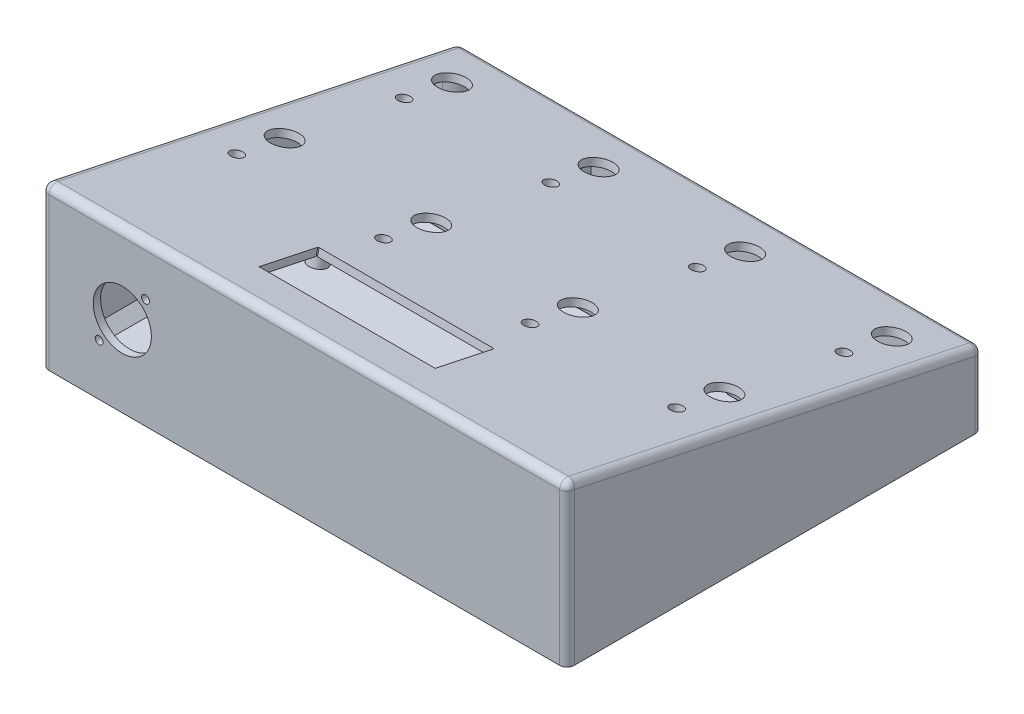
from build123d import *

# Parameters (mm, degrees)
FORME_BASE_PLAN_DROITE_DEPTH               = 215
COQUE1_T                                   = -3
ESQUISSE10_R                               = 6
ESQUISSE10_R_2                             = 2.6
PER_AGE_SWITCH_LED_DEPTH                   = 281.391917916
R_P_TITION_SWITCH_LED_COUNT                = 4
R_P_TITION_SWITCH_LED_PITCH                = 60
R_P_TITION_SWITCH_LED_COUNT_DIR2           = 2
R_P_TITION_SWITCH_LED_PITCH_DIR2           = 70
ESQUISSE13_W                               = 72
ESQUISSE13_H                               = 24.7
PER_AGE_CRAN_DEPTH                         = 3
PLOT_START                                 = -3
ESQUISSE14_R                               = 3.6
ESQUISSE14_R_2                             = 2.1
PLOT_CRAN_DEPTH                            = 7
R_P_TITION_PLOTS_ECRAN_COUNT               = 2
R_P_TITION_PLOTS_ECRAN_PITCH               = 75.4
R_P_TITION_PLOTS_ECRAN_COUNT_DIR2          = 2
R_P_TITION_PLOTS_ECRAN_PITCH_DIR2          = 31.4
BOSS_EXTRU_PLOTS_PICO_DEPTH                = 6
BOSS_EXTRU_PLOTS_PICO_DEPTH_BACK           = 2
ESQUISSE16_R                               = 3
D_POUILLE_PLOTS_PICO_ANGLE                 = 7.13
ESQUISSE18_R                               = 1.05
PER_AGE_PLOT_PICO_DEPTH                    = 7
ESQUISSE26_R                               = 11.9
ESQUISSE26_R_2                             = 1.6
ENL_V_MAT_EXTRU_4_DEPTH                    = 3
RENFORT_4_COINS_REACH                      = 283.924
ESQUISSE28_W                               = 9
ESQUISSE28_H                               = 9
R_P_TITION_4_COINS_OUTLINE_W               = 9
R_P_TITION_4_COINS_OUTLINE_H               = 9
R_P_TITION_4_COINS_DEPTH                   = 63
R_P_TITION_4_COINS_2_OUTLINE_W             = 9
R_P_TITION_4_COINS_2_OUTLINE_H             = 9
R_P_TITION_4_COINS_2_DEPTH                 = 29.474647714
BLOC_VIS_PROFONDEUR_DEPTH                  = 4.05
PLOT_VIS_LARGEUR_DEPTH                     = 4.05
PLOT_VIS_LARGEUR_R_P_TITION_COUNT          = 2
PLOT_VIS_LARGEUR_R_P_TITION_PITCH          = 107.5
PLOT_VIS_LARGEUR_R_P_TITION_COPY_1_DEPTH   = 4.05
ASSISE_COUVERCLE_PROFONDEUR_DEPTH          = 158
ASSISE_COUVERCLE_LARGEUR_DEPTH             = 203
ESQUISSE45_R                               = 4.45
TROU_PATINS_DEPTH                          = 4
R_P_TITION_PATINS_COUNT                    = 2
R_P_TITION_PATINS_PITCH                    = 158
R_P_TITION_PATINS_COUNT_DIR2               = 2
R_P_TITION_PATINS_PITCH_DIR2               = 203
BOSS_EXTRU_14_DEPTH                        = 15
BOSS_EXTRU_14_DEPTH_BACK                   = 2
ESQUISSE50_W                               = 209
ESQUISSE50_H                               = 4
ENL_V_MAT_EXTRU_6_REACH                    = 247.01
ESQUISSE59_R                               = 2.1
TROU_VIS_LARGEUR_DEPTH                     = 7
R_P_TITION_TROU_VIS_LARGEUR_COUNT          = 2
R_P_TITION_TROU_VIS_LARGEUR_PITCH          = 107.5
R_P_TITION_TROU_VIS_LARGEUR_COPY_1_SKETC_R = 2.1
R_P_TITION_TROU_VIS_LARGEUR_COPY_1_DEPTH   = 7
ESQUISSE62_R                               = 2.1
TROU_VIS_LONGEUR_DEPTH                     = 7
CONG_1_R                                   = 6
CONG_3_START                               = 3
CONG_3_DEPTH                               = 155.844279517
CONG_5_START                               = 3
CONG_5_DEPTH                               = 209
CONG_8_R                                   = 3
ENL_V_START                                = -2
ESQUISSE63_R                               = 2.1
ENL_V_MAT_EXTRU_9_DEPTH                    = 2
BOSS_EXTRU_17_DEPTH                        = 3
ESQUISSE68_R                               = 1.575
ENL_V_MAT_EXTRU_10_DEPTH                   = 3
ESQUISSE69_R                               = 1.575
ENL_V_MAT_EXTRU_11_DEPTH                   = 3
SYM_TRIE7_COPY_1_SKETCH_R                  = 1.575
SYM_TRIE7_COPY_1_DEPTH                     = 3
ENL_V_MAT_EXTRU_12_DEPTH                   = 2
ENL_V_MAT_EXTRU_14_DEPTH                   = 2
SYM_TRIE13_COPY_1_DEPTH                    = 2


with BuildPart() as part:
    # Esquisse1 → Forme base plan droite (new body)
    with BuildSketch(Plane(origin=(0, 0, 0), x_dir=(0, 0, -1), z_dir=(1, 0, 0))):
        Polygon((0, 0), (-170, 0), (-170, 66), (0, 30), align=None)
    extrude(amount=FORME_BASE_PLAN_DROITE_DEPTH)

    # Coque1
    coque1_openings = [part.faces().sort_by_distance(p)[0] for p in [
        (107.5, 0, 85),
    ]]
    offset(amount=COQUE1_T, openings=coque1_openings, kind=Kind.INTERSECTION)

    # Esquisse10 → Perçage switch-LED (cut, through all)
    with BuildSketch(Plane(origin=(0, 28.71241224, -6.080275533), x_dir=(1, 0, 0), z_dir=(0, 0.9783048645494206, -0.20717044190458303))):
        with Locations(Location((197.5, -26.215113257, 0), (0, 0, 270))):
            Circle(ESQUISSE10_R)
        with Locations(Location((197.5, -46.215113257, 0), (0, 0, 270))):
            Circle(ESQUISSE10_R_2)
    per_age_switch_led = extrude(amount=-PER_AGE_SWITCH_LED_DEPTH, mode=Mode.SUBTRACT)

    # Répétition switch-LED: Per_age switch-LED 4 × 2
    with Locations(*[Vector(-1, 0, 0) * (i * R_P_TITION_SWITCH_LED_PITCH) + Vector(0, 0.207170441904583, 0.9783048645494204) * (j * R_P_TITION_SWITCH_LED_PITCH_DIR2) for i in range(R_P_TITION_SWITCH_LED_COUNT) for j in range(R_P_TITION_SWITCH_LED_COUNT_DIR2) if (i, j) != (0, 0)]):
        add(per_age_switch_led, mode=Mode.SUBTRACT)

    # Esquisse13 → Perçage écran (cut)
    with BuildSketch(Plane(origin=(0, 28.71241224, -6.080275533), x_dir=(1, 0, 0), z_dir=(0, 0.9783048645494206, -0.20717044190458303))):
        with Locations((107.5, -149.735076139)):
            Rectangle(ESQUISSE13_W, ESQUISSE13_H)
    extrude(amount=-PER_AGE_CRAN_DEPTH, mode=Mode.SUBTRACT)

    # Esquisse14 → Plot écran (add)
    with BuildSketch(Plane(origin=(0, 25.777497646, -5.458764207), x_dir=(1, 0, 0), z_dir=(0, -0.9783048645494206, 0.20717044190458303)).offset(PLOT_START)):
        with Locations(Location((69.75, 165.835076139, 0), (0, 0, 270))):
            Circle(ESQUISSE14_R)
        with Locations(Location((69.75, 165.835076139, 0), (0, 0, 270))):
            Circle(ESQUISSE14_R_2, mode=Mode.SUBTRACT)
    plot_cran = extrude(amount=PLOT_CRAN_DEPTH)

    # Répétition plots Ecran: Plot _cran 2 × 2
    with Locations(*[Vector(1, 0, 0) * (i * R_P_TITION_PLOTS_ECRAN_PITCH) + Vector(0, -0.20717044190458217, -0.9783048645494207) * (j * R_P_TITION_PLOTS_ECRAN_PITCH_DIR2) for i in range(R_P_TITION_PLOTS_ECRAN_COUNT) for j in range(R_P_TITION_PLOTS_ECRAN_COUNT_DIR2) if (i, j) != (0, 0)]):
        add(plot_cran)

    # Esquisse16 → Boss.-Extru.  plots  pico (add, two sides: drawn at the far end of the back side and taken through both)
    with BuildSketch(Plane(origin=(0, 25.777497646, -5.458764207), x_dir=(-1, 0, 0), z_dir=(0, -0.9783048645494206, 0.20717044190458303)).offset(-BOSS_EXTRU_PLOTS_PICO_DEPTH_BACK)):
        with Locations(Location((-161.8, -149.859880815, 0), (0, 0, 90))):
            Circle(ESQUISSE16_R)
        with Locations(Location((-173.2, -149.859880815, 0), (0, 0, 90))):
            Circle(ESQUISSE16_R)
        with Locations(Location((-161.8, -102.859880815, 0), (0, 0, 90))):
            Circle(ESQUISSE16_R)
        with Locations(Location((-173.2, -102.859880815, 0), (0, 0, 90))):
            Circle(ESQUISSE16_R)
    extrude(amount=BOSS_EXTRU_PLOTS_PICO_DEPTH + BOSS_EXTRU_PLOTS_PICO_DEPTH_BACK)

    # Dépouille plots pico
    d_pouille_plots_pico_faces = [part.faces().sort_by_distance(p)[0] for p in [
        (161.8, 44.773621341, 98.72598348),
        (173.2, 44.773621341, 98.72598348),
        (173.2, 54.510632111, 144.706312114),
        (161.8, 54.510632111, 144.706312114),
    ]]
    draft(d_pouille_plots_pico_faces, Plane(origin=(215, 63.065085406, 170.621511326), x_dir=(0, -0.20717044190458306, -0.9783048645494204), z_dir=(0, -0.9783048645494204, 0.20717044190458306)), D_POUILLE_PLOTS_PICO_ANGLE)

    # Esquisse18 → Perçage plot pico (cut)
    with BuildSketch(Plane(origin=(0, 19.907668459, -4.215741556), x_dir=(1, 0, 0), z_dir=(0, -0.9783048645494206, 0.207170441904583))):
        with Locations(Location((161.8, 149.859880815, 0), (0, 0, 270))):
            Circle(ESQUISSE18_R)
        with Locations(Location((173.2, 149.859880815, 0), (0, 0, 270))):
            Circle(ESQUISSE18_R)
        with Locations(Location((161.8, 102.859880815, 0), (0, 0, 270))):
            Circle(ESQUISSE18_R)
        with Locations(Location((173.2, 102.859880815, 0), (0, 0, 270))):
            Circle(ESQUISSE18_R)
    extrude(amount=-PER_AGE_PLOT_PICO_DEPTH, mode=Mode.SUBTRACT)

    # Esquisse26 → Enlèv. mat.-Extru.4 (cut)
    with BuildSketch(Plane.XY.offset(170)):
        with Locations((33, 33)):
            Circle(ESQUISSE26_R)
        with Locations((23.5, 21)):
            Circle(ESQUISSE26_R_2)
        with Locations((42.5, 45)):
            Circle(ESQUISSE26_R_2)
    extrude(amount=-ENL_V_MAT_EXTRU_4_DEPTH, mode=Mode.SUBTRACT)

    # Renfort 4 coins: up to this plane
    renfort_4_coins_end = Plane(origin=(215, 63.065085406, 170.621511326), z_dir=(0, -0.9783048645494204, 0.20717044190458306))
    # Esquisse28 → Renfort 4 coins (add, up to the surface)
    with BuildSketch(Plane.XZ, mode=Mode.PRIVATE) as renfort_4_coins_sk1:
        with Locations((207.5, 7.5)):
            Rectangle(ESQUISSE28_W, ESQUISSE28_H)
    renfort_4_coins_tool1 = split(extrude(renfort_4_coins_sk1.sketch, amount=-RENFORT_4_COINS_REACH, mode=Mode.PRIVATE), bisect_by=renfort_4_coins_end, keep=Keep.BOTH, mode=Mode.PRIVATE)
    add(renfort_4_coins_tool1.solids().sort_by_distance((207.5, 0, 7.5))[0])

    # Répétition 4 coins: read off the stored shape, not the designer's step
    # Répétition 4 coins outline → Répétition 4 coins (add)
    with BuildSketch(Plane(origin=(0, 0, 0), x_dir=(1, 0, 0), z_dir=(0, 1, 0))):
        with Locations((207.5, -162.5)):
            Rectangle(R_P_TITION_4_COINS_OUTLINE_W, R_P_TITION_4_COINS_OUTLINE_H)
        with Locations((7.5, -162.5)):
            Rectangle(R_P_TITION_4_COINS_OUTLINE_W, R_P_TITION_4_COINS_OUTLINE_H)
    extrude(amount=R_P_TITION_4_COINS_DEPTH)

    # R_p_tition 4 coins 2 outline → R_p_tition 4 coins 2 (add)
    with BuildSketch(Plane(origin=(0, 0, 0), x_dir=(1, 0, 0), z_dir=(0, 1, 0))):
        with Locations((7.5, -7.5)):
            Rectangle(R_P_TITION_4_COINS_2_OUTLINE_W, R_P_TITION_4_COINS_2_OUTLINE_H)
    extrude(amount=R_P_TITION_4_COINS_2_DEPTH)

    # Esquisse36 → Bloc  vis  profondeur (add, symmetric)
    with BuildSketch(Plane.XY.offset(85)):
        Polygon((212, 3), (203.9, 3), (203.9, 13), (212, 21.1), (212, 13), align=None)
    bloc_vis_profondeur = extrude(amount=BLOC_VIS_PROFONDEUR_DEPTH, both=True)

    # Symétrie2: Bloc  vis  profondeur across plane
    add(bloc_vis_profondeur.mirror(Plane(origin=(107.5, 0, 0), x_dir=(0, 0, 1), z_dir=(1, 0, 0))))

    # Esquisse39 → plot vis largeur (add, symmetric)
    with BuildSketch(Plane(origin=(53.75, 0, 0), x_dir=(0, 0, -1), z_dir=(1, 0, 0))):
        Polygon((-11.1, 13), (-3, 21.1), (-3, 13), (-3, 3), (-11.1, 3), align=None)
    plot_vis_largeur = extrude(amount=PLOT_VIS_LARGEUR_DEPTH, both=True)

    # plot vis largeur symétrie: plot vis largeur across plane
    add(plot_vis_largeur.mirror(Plane.XY.offset(85)))

    # plot vis largeur répétition: plot vis largeur ×2
    with Locations(*[(i * PLOT_VIS_LARGEUR_R_P_TITION_PITCH, 0, 0) for i in range(1, PLOT_VIS_LARGEUR_R_P_TITION_COUNT)]):
        add(plot_vis_largeur)

    # plot vis largeur répétition copy 1 sketc → plot vis largeur répétition copy 1 (add, symmetric)
    with BuildSketch(Plane(origin=(161.25, 0, 170), x_dir=(0, 0, 1), z_dir=(1, 0, 0))):
        Polygon((-11.1, -13), (-3, -21.1), (-3, -13), (-3, -3), (-11.1, -3), align=None)
    extrude(amount=PLOT_VIS_LARGEUR_R_P_TITION_COPY_1_DEPTH, both=True)

    # Esquisse42 → assise couvercle profondeur (add, through all)
    with BuildSketch(Plane(origin=(0, 0, 158), x_dir=(-1, 0, 0), z_dir=(0, 0, -1))):
        Polygon((-3, 3), (-7.05, 3), (-3, 7.05), align=None)
    assise_couvercle_profondeur = extrude(amount=ASSISE_COUVERCLE_PROFONDEUR_DEPTH)

    # Symétrie assise couvercle profondeur: assise couvercle profondeur across plane
    add(assise_couvercle_profondeur.mirror(Plane(origin=(107.5, 0, 0), x_dir=(0, 0, 1), z_dir=(1, 0, 0))))

    # Esquisse43 → Assise couvercle largeur (add, through all)
    with BuildSketch(Plane(origin=(12, 0, 0), x_dir=(0, 0, -1), z_dir=(1, 0, 0))):
        Polygon((-167, 3), (-162.95, 3), (-167, 7.05), align=None)
    assise_couvercle_largeur = extrude(amount=ASSISE_COUVERCLE_LARGEUR_DEPTH)

    # Symétrie Assise couvercle largeur: Assise couvercle largeur across plane
    add(assise_couvercle_largeur.mirror(Plane.XY.offset(85)))

    # Esquisse45 → Trou patins (cut)
    with BuildSketch(Plane.XZ):
        with Locations(Location((6, 6, 0), (0, 0, 270))):
            Circle(ESQUISSE45_R)
    trou_patins = extrude(amount=-TROU_PATINS_DEPTH, mode=Mode.SUBTRACT)

    # Répétition patins: Trou patins 2 × 2
    with Locations(*[(j * R_P_TITION_PATINS_PITCH_DIR2, 0, i * R_P_TITION_PATINS_PITCH) for i in range(R_P_TITION_PATINS_COUNT) for j in range(R_P_TITION_PATINS_COUNT_DIR2) if (i, j) != (0, 0)]):
        add(trou_patins, mode=Mode.SUBTRACT)

    # Esquisse50 → Boss.-Extru.14 (add, two sides: drawn at the far end of the back side and taken through both)
    with BuildSketch(Plane(origin=(0, 25.777497646, -5.458764207), x_dir=(1, 0, 0), z_dir=(0, -0.9783048645494204, 0.20717044190458306)).offset(-BOSS_EXTRU_14_DEPTH_BACK)):
        with Locations((107.5, 68.215113257)):
            Rectangle(ESQUISSE50_W, ESQUISSE50_H)
    extrude(amount=BOSS_EXTRU_14_DEPTH + BOSS_EXTRU_14_DEPTH_BACK)

    # Esquisse51 → Enlèv. mat.-Extru.6 (cut, up to next)
    with BuildSketch(Plane(origin=(0, 13.717814274, 64.778567406), x_dir=(-1, 0, 0), z_dir=(0, -0.20717044190458314, -0.9783048645494204)), mode=Mode.PRIVATE) as enl_v_mat_extru_6_sk1:
        with BuildLine():
            Line((-158.616222669, 11.349145936), (-176.383777331, 11.349145936))
            ThreePointArc((-176.383777331, 11.349145936), (-167.5, 20.232923267), (-158.616222669, 11.349145936))
        make_face()
    enl_v_mat_extru_6_tool1 = extrude(enl_v_mat_extru_6_sk1.sketch, amount=-ENL_V_MAT_EXTRU_6_REACH, mode=Mode.PRIVATE) & part.part
    add(enl_v_mat_extru_6_tool1.solids().sort_by_distance((167.5, 28.509332, 61.646246))[0], mode=Mode.SUBTRACT)

    # Esquisse59 → Trou vis largeur (cut)
    with BuildSketch(Plane.XZ.offset(-3)):
        with Locations(Location((53.75, 7.05, 0), (0, 0, 270))):
            Circle(ESQUISSE59_R)
    trou_vis_largeur = extrude(amount=-TROU_VIS_LARGEUR_DEPTH, mode=Mode.SUBTRACT)

    # Symétrie3 Trou vis largeur: Trou vis largeur across plane
    add(trou_vis_largeur.mirror(Plane.XY.offset(85)), mode=Mode.SUBTRACT)

    # Répétition Trou vis largeur: Trou vis largeur ×2
    with Locations(*[(i * R_P_TITION_TROU_VIS_LARGEUR_PITCH, 0, 0) for i in range(1, R_P_TITION_TROU_VIS_LARGEUR_COUNT)]):
        add(trou_vis_largeur, mode=Mode.SUBTRACT)

    # Répétition Trou vis largeur copy 1 sketc → Répétition Trou vis largeur copy 1 (cut)
    with BuildSketch(Plane(origin=(107.5, 3, 170), x_dir=(1, 0, 0), z_dir=(0, -1, 0))):
        with Locations((53.75, -7.05)):
            Circle(R_P_TITION_TROU_VIS_LARGEUR_COPY_1_SKETC_R)
    extrude(amount=-R_P_TITION_TROU_VIS_LARGEUR_COPY_1_DEPTH, mode=Mode.SUBTRACT)

    # Esquisse62 → trou vis longeur (cut)
    with BuildSketch(Plane.XZ.offset(-3)):
        with Locations((7.05, 85)):
            Circle(ESQUISSE62_R)
    trou_vis_longeur = extrude(amount=-TROU_VIS_LONGEUR_DEPTH, mode=Mode.SUBTRACT)

    # Symétrie4: trou vis longeur across plane
    add(trou_vis_longeur.mirror(Plane(origin=(107.5, 0, 0), x_dir=(0, 0, 1), z_dir=(1, 0, 0))), mode=Mode.SUBTRACT)

    # Congé1
    # the kernel refuses this fillet: 6 mm, written as the material it takes off along each edge
    with BuildSketch(Plane(origin=(203, -15, 12), x_dir=(0, 0, -1), z_dir=(0, 1, 0))) as cong_1_piece_1_section:
        with BuildLine():
            CenterArc((CONG_1_R, -CONG_1_R), CONG_1_R, 90, 90)
            Line((0, -CONG_1_R), (0, 0))
            Line((0, 0), (CONG_1_R, 0))
        make_face()
    cong_1_piece_1 = extrude(amount=59.474647714, mode=Mode.PRIVATE)
    cong_1_piece_1 = split(cong_1_piece_1, bisect_by=Plane(origin=(203, 3, 12), z_dir=(0, -1, 0)), keep=Keep.TOP, mode=Mode.PRIVATE)
    add(cong_1_piece_1, mode=Mode.SUBTRACT)
    with BuildSketch(Plane(origin=(203, -15, 12), x_dir=(0, 0, -1), z_dir=(0, 1, 0))) as cong_1_piece_2_section:
        with BuildLine():
            CenterArc((CONG_1_R, -CONG_1_R), CONG_1_R, 90, 90)
            Line((0, -CONG_1_R), (0, 0))
            Line((0, 0), (CONG_1_R, 0))
        make_face()
    cong_1_piece_2 = extrude(amount=59.474647714, mode=Mode.PRIVATE)
    cong_1_piece_2 = split(cong_1_piece_2, bisect_by=Plane(origin=(203, 27.56581398, 2.986062922), z_dir=(0, -0.9783048645494204, 0.207170441904583)), keep=Keep.TOP, mode=Mode.PRIVATE)
    cong_1_piece_2 = split(cong_1_piece_2, bisect_by=Plane(origin=(203, -8.475, 18.525), z_dir=(0, 0.7071067811865483, 0.7071067811865468)), keep=Keep.TOP, mode=Mode.PRIVATE)
    cong_1_piece_2 = split(cong_1_piece_2, bisect_by=Plane(origin=(196.475, -8.475, 12), z_dir=(-0.7071067811865478, 0.7071067811865474, 0)), keep=Keep.TOP, mode=Mode.PRIVATE)
    add(cong_1_piece_2, mode=Mode.SUBTRACT)
    with BuildSketch(Plane(origin=(203, -15, 158), x_dir=(1, 0, 0), z_dir=(0, 1, 0))) as cong_1_piece_3_section:
        with BuildLine():
            CenterArc((CONG_1_R, -CONG_1_R), CONG_1_R, 90, 90)
            Line((0, -CONG_1_R), (0, 0))
            Line((0, 0), (CONG_1_R, 0))
        make_face()
    cong_1_piece_3 = extrude(amount=90.392294773, mode=Mode.PRIVATE)
    cong_1_piece_3 = split(cong_1_piece_3, bisect_by=Plane(origin=(203, 3, 158), z_dir=(0, -1, 0)), keep=Keep.TOP, mode=Mode.PRIVATE)
    add(cong_1_piece_3, mode=Mode.SUBTRACT)
    with BuildSketch(Plane(origin=(203, -15, 158), x_dir=(1, 0, 0), z_dir=(0, 1, 0))) as cong_1_piece_4_section:
        with BuildLine():
            CenterArc((CONG_1_R, -CONG_1_R), CONG_1_R, 90, 90)
            Line((0, -CONG_1_R), (0, 0))
            Line((0, 0), (CONG_1_R, 0))
        make_face()
    cong_1_piece_4 = extrude(amount=90.392294773, mode=Mode.PRIVATE)
    cong_1_piece_4 = split(cong_1_piece_4, bisect_by=Plane(origin=(203, 57.156488241, 142.71980249), z_dir=(0, -0.9783048645494204, 0.207170441904583)), keep=Keep.TOP, mode=Mode.PRIVATE)
    cong_1_piece_4 = split(cong_1_piece_4, bisect_by=Plane(origin=(196.475, -8.475, 158), z_dir=(-0.7071067811865478, 0.7071067811865474, 0)), keep=Keep.TOP, mode=Mode.PRIVATE)
    cong_1_piece_4 = split(cong_1_piece_4, bisect_by=Plane(origin=(203, -8.475, 151.475), z_dir=(0, 0.7071067811865483, -0.7071067811865468)), keep=Keep.TOP, mode=Mode.PRIVATE)
    add(cong_1_piece_4, mode=Mode.SUBTRACT)
    with BuildSketch(Plane(origin=(12, -15, 12), x_dir=(0, 0, -1), z_dir=(0, 1, 0))) as cong_1_piece_5_section:
        with BuildLine():
            CenterArc((CONG_1_R, CONG_1_R), CONG_1_R, 180, 90)
            Line((0, CONG_1_R), (0, 0))
            Line((0, 0), (CONG_1_R, 0))
        make_face()
    cong_1_piece_5 = extrude(amount=59.474647714, mode=Mode.PRIVATE)
    cong_1_piece_5 = split(cong_1_piece_5, bisect_by=Plane(origin=(12, 3, 12), z_dir=(0, -1, 0)), keep=Keep.TOP, mode=Mode.PRIVATE)
    add(cong_1_piece_5, mode=Mode.SUBTRACT)
    with BuildSketch(Plane(origin=(12, -15, 12), x_dir=(0, 0, -1), z_dir=(0, 1, 0))) as cong_1_piece_6_section:
        with BuildLine():
            CenterArc((CONG_1_R, CONG_1_R), CONG_1_R, 180, 90)
            Line((0, CONG_1_R), (0, 0))
            Line((0, 0), (CONG_1_R, 0))
        make_face()
    cong_1_piece_6 = extrude(amount=59.474647714, mode=Mode.PRIVATE)
    cong_1_piece_6 = split(cong_1_piece_6, bisect_by=Plane(origin=(12, -8.475, 18.525), z_dir=(0, 0.7071067811865483, 0.7071067811865468)), keep=Keep.TOP, mode=Mode.PRIVATE)
    cong_1_piece_6 = split(cong_1_piece_6, bisect_by=Plane(origin=(12, 27.56581398, 2.986062922), z_dir=(0, -0.9783048645494204, 0.207170441904583)), keep=Keep.TOP, mode=Mode.PRIVATE)
    cong_1_piece_6 = split(cong_1_piece_6, bisect_by=Plane(origin=(18.525, -8.475, 12), z_dir=(0.7071067811865478, 0.7071067811865474, 0)), keep=Keep.TOP, mode=Mode.PRIVATE)
    add(cong_1_piece_6, mode=Mode.SUBTRACT)
    with BuildSketch(Plane(origin=(12, -15, 158), x_dir=(-1, 0, 0), z_dir=(0, 1, 0))) as cong_1_piece_7_section:
        with BuildLine():
            CenterArc((CONG_1_R, CONG_1_R), CONG_1_R, 180, 90)
            Line((0, CONG_1_R), (0, 0))
            Line((0, 0), (CONG_1_R, 0))
        make_face()
    cong_1_piece_7 = extrude(amount=90.392294773, mode=Mode.PRIVATE)
    cong_1_piece_7 = split(cong_1_piece_7, bisect_by=Plane(origin=(12, 3, 158), z_dir=(0, -1, 0)), keep=Keep.TOP, mode=Mode.PRIVATE)
    add(cong_1_piece_7, mode=Mode.SUBTRACT)
    with BuildSketch(Plane(origin=(12, -15, 158), x_dir=(-1, 0, 0), z_dir=(0, 1, 0))) as cong_1_piece_8_section:
        with BuildLine():
            CenterArc((CONG_1_R, CONG_1_R), CONG_1_R, 180, 90)
            Line((0, CONG_1_R), (0, 0))
            Line((0, 0), (CONG_1_R, 0))
        make_face()
    cong_1_piece_8 = extrude(amount=90.392294773, mode=Mode.PRIVATE)
    cong_1_piece_8 = split(cong_1_piece_8, bisect_by=Plane(origin=(18.525, -8.475, 158), z_dir=(0.7071067811865478, 0.7071067811865474, 0)), keep=Keep.TOP, mode=Mode.PRIVATE)
    cong_1_piece_8 = split(cong_1_piece_8, bisect_by=Plane(origin=(12, 57.156488241, 142.71980249), z_dir=(0, -0.9783048645494204, 0.207170441904583)), keep=Keep.TOP, mode=Mode.PRIVATE)
    cong_1_piece_8 = split(cong_1_piece_8, bisect_by=Plane(origin=(12, -8.475, 151.475), z_dir=(0, 0.7071067811865483, -0.7071067811865468)), keep=Keep.TOP, mode=Mode.PRIVATE)
    add(cong_1_piece_8, mode=Mode.SUBTRACT)

    # Congé3: read off the stored shape, not the designer's step
    # Congé3 outline → Congé3 (cut)
    with BuildSketch(Plane.YZ.offset(CONG_3_START)):
        with BuildLine():
            ThreePointArc((26.777348681, 62.013018943), (25.51517433, 62.879079881), (25.23507982, 64.383969479))
            Line((25.23507982, 64.383969479), (24.820738952, 62.427359827))
            Line((24.820738952, 62.427359827), (26.777348681, 62.013018943))
        make_face()
        with BuildLine():
            ThreePointArc((25.23507982, 64.383969479), (26.101140773, 65.646143907), (27.606030449, 65.926238402))
            Line((27.606030449, 65.926238402), (25.64942072, 66.340579285))
            Line((25.64942072, 66.340579285), (25.23507982, 64.383969479))
        make_face()
    extrude(amount=CONG_3_DEPTH, mode=Mode.SUBTRACT)

    # Congé5: read off the stored shape, not the designer's step
    # Congé5 outline → Congé5 (cut)
    with BuildSketch(Plane.YZ.offset(CONG_5_START)):
        with BuildLine():
            ThreePointArc((26.777348681, 62.013018943), (25.51517433, 62.879079881), (25.23507982, 64.383969479))
            Line((25.23507982, 64.383969479), (24.820738952, 62.427359827))
            Line((24.820738952, 62.427359827), (26.777348681, 62.013018943))
        make_face()
        with BuildLine():
            ThreePointArc((25.23507982, 64.383969479), (26.101140773, 65.646143907), (27.606030449, 65.926238402))
            Line((27.606030449, 65.926238402), (25.64942072, 66.340579285))
            Line((25.64942072, 66.340579285), (25.23507982, 64.383969479))
        make_face()
    extrude(amount=CONG_5_DEPTH, mode=Mode.SUBTRACT)

    # Congé8
    cong_8_edges = [part.edges().sort_by_distance(p)[0] for p in [
        (215, 33, 170),
        (215, 15, 0),
        (0, 33, 170),
        (0, 48, 85),
        (0, 15, 0),
        (107.5, 66, 170),
        (107.5, 30, 0),
        (215, 48, 85),
    ]]
    fillet(cong_8_edges, radius=CONG_8_R)

    # Esquisse63 → Enlèv. mat.-Extru.9 (cut)
    with BuildSketch(Plane(origin=(0, 25.777497646, -5.458764207), x_dir=(1, 0, 0), z_dir=(0, -0.9783048645494204, 0.20717044190458314)).offset(ENL_V_START)):
        with Locations(Location((69.75, 165.835076139, 0), (0, 0, 270))):
            Circle(ESQUISSE63_R)
        with Locations(Location((69.75, 134.435076139, 0), (0, 0, 270))):
            Circle(ESQUISSE63_R)
        with Locations(Location((145.15, 134.435076139, 0), (0, 0, 270))):
            Circle(ESQUISSE63_R)
        with Locations(Location((145.15, 165.835076139, 0), (0, 0, 270))):
            Circle(ESQUISSE63_R)
    extrude(amount=ENL_V_MAT_EXTRU_9_DEPTH, mode=Mode.SUBTRACT)


with BuildPart() as body_2:
    # Esquisse67 → Boss.-Extru.17 (new body)
    with BuildSketch(Plane(origin=(0, 0, 0), x_dir=(1, 0, 0), z_dir=(0, 1, 0))):
        with BuildLine():
            Line((12.2, -164), (12.2, -166.8))
            Line((12.2, -166.8), (202.8, -166.8))
            Line((202.8, -166.8), (202.8, -164))
            ThreePointArc((202.8, -164), (204.615937957, -159.615937957), (209, -157.8))
            Line((209, -157.8), (211.8, -157.8))
            Line((211.8, -157.8), (211.8, -12.2))
            Line((211.8, -12.2), (209, -12.2))
            ThreePointArc((209, -12.2), (204.615937957, -10.384062043), (202.8, -6))
            Line((202.8, -6), (202.8, -3.2))
            Line((202.8, -3.2), (12.2, -3.2))
            Line((12.2, -3.2), (12.2, -6))
            ThreePointArc((12.2, -6), (10.384062043, -10.384062043), (6, -12.2))
            Line((6, -12.2), (3.2, -12.2))
            Line((3.2, -12.2), (3.2, -157.8))
            Line((3.2, -157.8), (6, -157.8))
            ThreePointArc((6, -157.8), (10.384062043, -159.615937957), (12.2, -164))
        make_face()
    extrude(amount=BOSS_EXTRU_17_DEPTH)

    # Esquisse68 → Enlèv. mat.-Extru.10 (cut)
    with BuildSketch(Plane.XZ):
        with Locations(Location((7.05, 85, 0), (0, 0, 270))):
            Circle(ESQUISSE68_R)
    enl_v_mat_extru_10 = extrude(amount=-ENL_V_MAT_EXTRU_10_DEPTH, mode=Mode.SUBTRACT)

    # Symétrie5: Enlèv. mat.-Extru.10 across plane
    add(enl_v_mat_extru_10.mirror(Plane(origin=(107.5, 0, 0), x_dir=(0, 0, 1), z_dir=(1, 0, 0))), mode=Mode.SUBTRACT)

    # Esquisse69 → Enlèv. mat.-Extru.11 (cut)
    with BuildSketch(Plane.XZ):
        with Locations(Location((53.75, 7.05, 0), (0, 0, 270))):
            Circle(ESQUISSE69_R)
    enl_v_mat_extru_11 = extrude(amount=-ENL_V_MAT_EXTRU_11_DEPTH, mode=Mode.SUBTRACT)

    # Symétrie6: Enlèv. mat.-Extru.11 across plane
    add(enl_v_mat_extru_11.mirror(Plane.XY.offset(85)), mode=Mode.SUBTRACT)

    # Symétrie7: Enlèv. mat.-Extru.11 across plane
    add(enl_v_mat_extru_11.mirror(Plane(origin=(107.5, 0, 0), x_dir=(0, 0, 1), z_dir=(1, 0, 0))), mode=Mode.SUBTRACT)

    # Symétrie7 copy 1 sketch → Symétrie7 copy 1 (cut)
    with BuildSketch(Plane(origin=(215, 0, 170), x_dir=(-1, 0, 0), z_dir=(0, -1, 0))):
        with Locations(Location((53.75, 7.05, 0), (0, 0, 270))):
            Circle(SYM_TRIE7_COPY_1_SKETCH_R)
    extrude(amount=-SYM_TRIE7_COPY_1_DEPTH, mode=Mode.SUBTRACT)

    # Esquisse70 → Enlèv. mat.-Extru.12 (cut)
    with BuildSketch(Plane.XZ):
        with BuildLine():
            Line((3.2, 88), (7.05, 88))
            ThreePointArc((7.05, 88), (10.05, 85), (7.05, 82))
            Line((7.05, 82), (3.2, 82))
            Line((3.2, 82), (3.2, 88))
        make_face()
    enl_v_mat_extru_12 = extrude(amount=-ENL_V_MAT_EXTRU_12_DEPTH, mode=Mode.SUBTRACT)

    # Symétrie8: Enlèv. mat.-Extru.12 across plane
    add(enl_v_mat_extru_12.mirror(Plane(origin=(107.5, 0, 0), x_dir=(0, 0, 1), z_dir=(1, 0, 0))), mode=Mode.SUBTRACT)

    # Esquisse72 → Enlèv. mat.-Extru.14 (cut)
    with BuildSketch(Plane.XZ):
        with BuildLine():
            Line((50.75, 3.2), (50.75, 7.05))
            ThreePointArc((50.75, 7.05), (53.75, 10.05), (56.75, 7.05))
            Line((56.75, 7.05), (56.75, 3.2))
            Line((56.75, 3.2), (50.75, 3.2))
        make_face()
    enl_v_mat_extru_14 = extrude(amount=-ENL_V_MAT_EXTRU_14_DEPTH, mode=Mode.SUBTRACT)

    # Symétrie11: Enlèv. mat.-Extru.14 across plane
    add(enl_v_mat_extru_14.mirror(Plane.XY.offset(85)), mode=Mode.SUBTRACT)

    # Symétrie13: Enlèv. mat.-Extru.14 across plane
    add(enl_v_mat_extru_14.mirror(Plane(origin=(107.5, 0, 0), x_dir=(0, 0, 1), z_dir=(1, 0, 0))), mode=Mode.SUBTRACT)

    # Symétrie13 copy 1 sketch → Symétrie13 copy 1 (cut)
    with BuildSketch(Plane(origin=(215, 0, 170), x_dir=(-1, 0, 0), z_dir=(0, -1, 0))):
        with BuildLine():
            Line((50.75, 3.2), (50.75, 7.05))
            ThreePointArc((50.75, 7.05), (53.75, 10.05), (56.75, 7.05))
            Line((56.75, 7.05), (56.75, 3.2))
            Line((56.75, 3.2), (50.75, 3.2))
        make_face()
    extrude(amount=-SYM_TRIE13_COPY_1_DEPTH, mode=Mode.SUBTRACT)


solid = Compound([part.part, body_2.part])
